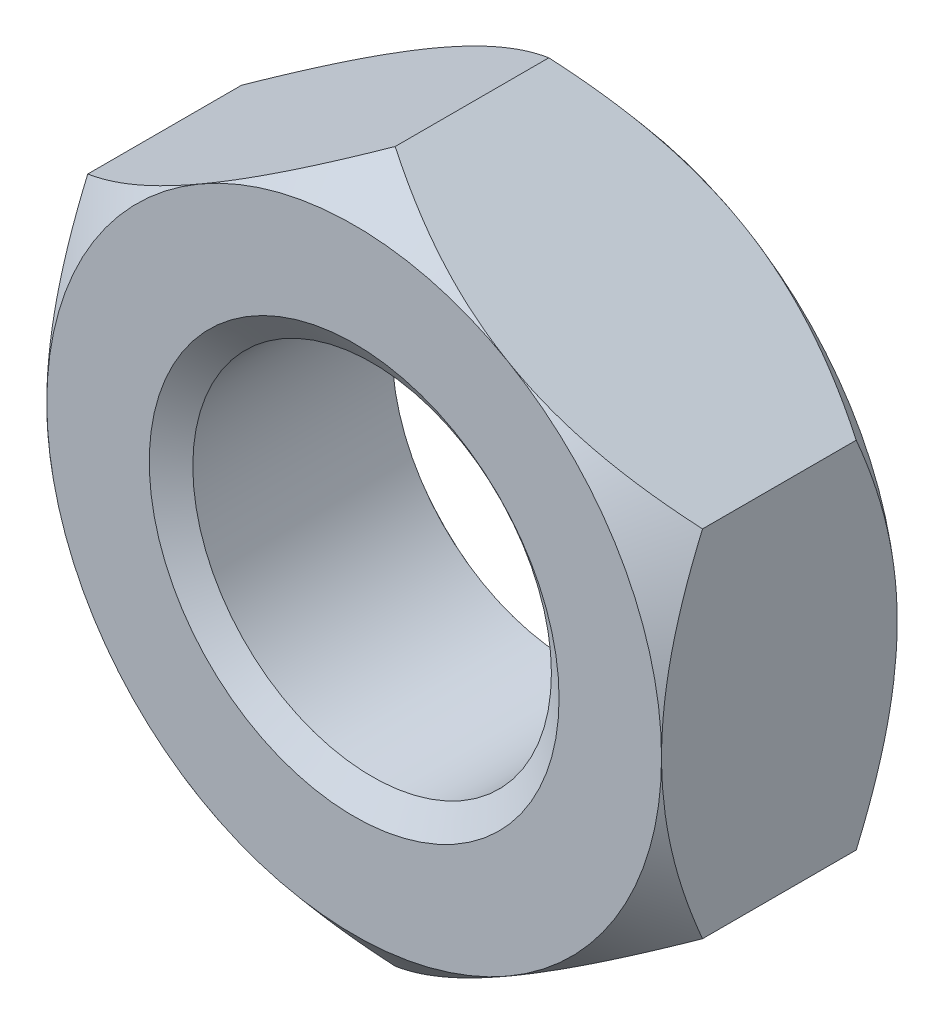
from build123d import *

# Parameters (mm, degrees)
THREADSCHEMATIC_START     = -14.605
THREADSCHEMATIC_OUTLINE_R = 11.1125
THREADSCHEMATIC_DEPTH     = 14.605


# Read off the part's stored shape, not the designer's step: ThreadSchematic
with BuildPart() as part:
    # ThreadSchematic outline → ThreadSchematic (new body)
    with BuildSketch(Plane.XY.offset(THREADSCHEMATIC_START)):
        Polygon((19.05, 10.998522628), (0, 21.997045256), (-19.05, 10.998522628), (-19.05, -10.998522628), (0, -21.997045256), (19.05, -10.998522628), align=None)
        Circle(THREADSCHEMATIC_OUTLINE_R, mode=Mode.SUBTRACT)
    extrude(amount=THREADSCHEMATIC_DEPTH)

    # Sketch3 → Double-Chamfer (revolve, cut)
    with BuildSketch(Plane(origin=(0, 0, 0), x_dir=(0, 0, -1), z_dir=(1, 0, 0))):
        Polygon((14.605, 19.05), (12.065, 21.997045256), (12.065, 34.697045256), (27.305, 34.697045256), (27.305, 19.05), align=None)
        Polygon((2.54, 34.697045256), (-12.7, 34.697045256), (-12.7, 19.05), (0, 19.05), (2.54, 21.997045256), align=None)
    revolve(axis=Axis((0, 0, 0), (0, 0, -1)), mode=Mode.SUBTRACT)

    # EndChamferSke → EndChamfer (revolve, cut)
    with BuildSketch(Plane(origin=(0, 0, 0), x_dir=(0, 0, -1), z_dir=(1, 0, 0)), mode=Mode.PRIVATE) as endchamfer_sk:
        Polygon((14.5796, 12.7), (13.356862586, 10.95375), (14.6304, 10.95375), (14.6304, 12.7), align=None)
        Polygon((-0.0508, 12.7), (0, 12.7), (1.222737414, 10.95375), (-0.0508, 10.95375), align=None)
    revolve(endchamfer_sk.sketch.rotate(Axis((0, 0, -25.037505729), (0, 0, -1)), 90), axis=Axis((0, 0, -25.037505729), (0, 0, -1)), mode=Mode.SUBTRACT)


solid = part.part
